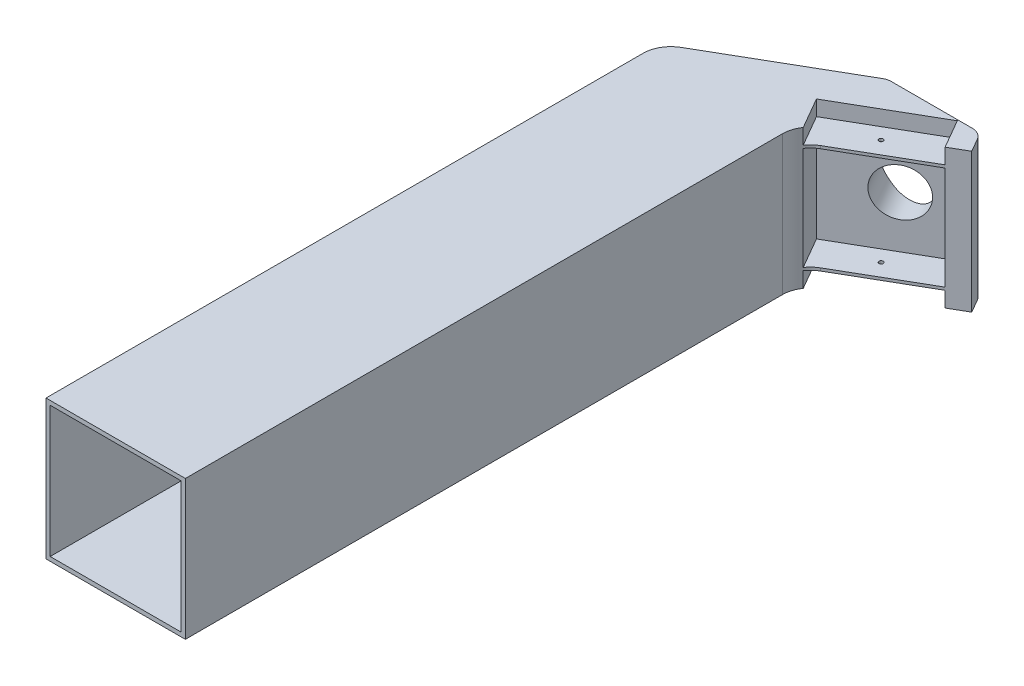
from build123d import *

# Parameters (mm, degrees)
SKETCH_1_W           = 50
SKETCH_1_H           = 50
EXTRUDE_1_DEPTH      = 220
EXTRUDE_2_DEPTH      = 50
SKETCH_4_W           = 37
SKETCH_4_H           = 37
CUT_EXTRUDE_2_DEPTH  = 12
CUT_EXTRUDE_3_REACH  = 235.922
SKETCH_5_R           = 8.5
SKETCH_8_R           = 0.75
CUT_EXTRUDE_4_DEPTH  = 6.5
CUT_EXTRUDE_START    = -6.5
SKETCH_7_R           = 0.75
CUT_EXTRUDE_5_DEPTH  = 6.5
CUT_EXTRUDE_6_DEPTH  = 5.5
CUT_EXTRUDE_7_DEPTH  = 5.5
CUT_EXTRUDE_8_DEPTH  = 50
FILLET_1_R           = 5
FILLET_2_R           = 5
FILLET_3_R           = 10
FILLET_4_R           = 10
SKETCH_13_W          = 47
SKETCH_13_H          = 47
CUT_EXTRUDE_9_DEPTH  = 50
SKETCH_2_W           = 43
SKETCH_2_H           = 43
CUT_EXTRUDE_10_DEPTH = 150
FILLET_5_R           = 5


with BuildPart() as part:
    # 草图1 → 凸台-拉伸1 (new body)
    with BuildSketch(Plane.XY):
        Rectangle(SKETCH_1_W, SKETCH_1_H)
    extrude(amount=EXTRUDE_1_DEPTH)

    # 草图3 → 凸台-拉伸2 (add)
    with BuildSketch(Plane(origin=(0, 25, 0), x_dir=(1, 0, 0), z_dir=(0, 1, 0))):
        Polygon((25, 0), (-25, 0), (26.961524227, 30), (76.961524227, 30), align=None)
    extrude(amount=-EXTRUDE_2_DEPTH)

    # 草图4 → 切除-拉伸2 (cut)
    with BuildSketch(Plane(origin=(6.25, 0, 10.825317547), x_dir=(0.8660254037844415, 0, -0.4999999999999951), z_dir=(0.4999999999999951, 0, 0.8660254037844415))):
        with Locations((41.650635095, 0)):
            Rectangle(SKETCH_4_W, SKETCH_4_H)
    extrude(amount=-CUT_EXTRUDE_2_DEPTH, mode=Mode.SUBTRACT)

    # 切除-拉伸3: up to this face of the body (flat: up to its plane)
    cut_extrude_3_end = Plane(part.part.faces().sort_by_distance((0.980762114, 0, -15))[0])
    # 草图5 → 切除-拉伸3 (cut, up to the picked face)
    with BuildSketch(Plane(origin=(0.25, 0, 0.433012702), x_dir=(0.8660254037844415, 0, -0.4999999999999951), z_dir=(0.4999999999999951, 0, 0.8660254037844415)), mode=Mode.PRIVATE) as cut_extrude_3_sk1:
        with Locations((45.150635095, 0)):
            Circle(SKETCH_5_R)
    cut_extrude_3_tool1 = split(extrude(cut_extrude_3_sk1.sketch, amount=-CUT_EXTRUDE_3_REACH, mode=Mode.PRIVATE), bisect_by=cut_extrude_3_end, keep=Keep.BOTH, mode=Mode.PRIVATE)
    add(cut_extrude_3_tool1.solids().sort_by(Axis((39.351597, 0, -22.142305), (-0.4999999999999951, 0, -0.8660254037844415)))[0], mode=Mode.SUBTRACT)

    # 草图8 → 切除-拉伸4 (cut)
    with BuildSketch(Plane.XZ.offset(-18.5)):
        with Locations((39.170508076, -15.455960044)):
            Circle(SKETCH_8_R)
    extrude(amount=-CUT_EXTRUDE_4_DEPTH, mode=Mode.SUBTRACT)

    # 草图7 → 切除-拉伸5 (cut)
    with BuildSketch(Plane(origin=(0, -18.5, 0), x_dir=(1, 0, 0), z_dir=(0, 1, 0)).offset(CUT_EXTRUDE_START)):
        with Locations((39.170508076, 15.455960044)):
            Circle(SKETCH_7_R)
    extrude(amount=CUT_EXTRUDE_5_DEPTH, mode=Mode.SUBTRACT)

    # 草图10 → 切除-拉伸6 (cut)
    with BuildSketch(Plane.XZ.offset(25)):
        Polygon((58.341978046, -19.25), (26.299038106, -0.75), (20.299038106, -11.142304845), (52.341978046, -29.642304845), align=None)
    extrude(amount=-CUT_EXTRUDE_6_DEPTH, mode=Mode.SUBTRACT)

    # 草图11 → 切除-拉伸7 (cut)
    with BuildSketch(Plane(origin=(0, 25, 0), x_dir=(1, 0, 0), z_dir=(0, 1, 0))):
        Polygon((26.299038106, 0.75), (58.341978046, 19.25), (52.341978046, 29.642304845), (20.299038106, 11.142304845), align=None)
    extrude(amount=-CUT_EXTRUDE_7_DEPTH, mode=Mode.SUBTRACT)

    # 草图12 → 切除-拉伸8 (cut)
    with BuildSketch(Plane.XZ.offset(25)):
        Polygon((64.404155872, -22.75), (60.218366421, -30), (76.961524227, -30), align=None)
    extrude(amount=-CUT_EXTRUDE_8_DEPTH, mode=Mode.SUBTRACT)

    # 圆角1
    fillet_1_edges = [part.edges().sort_by_distance(p)[0] for p in [
        (60.218366421, 0, -30),
    ]]
    fillet(fillet_1_edges, radius=FILLET_1_R)

    # 圆角2
    fillet_2_edges = [part.edges().sort_by_distance(p)[0] for p in [
        (26.961524227, -15.049152987, -30),
    ]]
    fillet(fillet_2_edges, radius=FILLET_2_R)

    # 圆角3
    fillet_3_edges = [part.edges().sort_by_distance(p)[0] for p in [
        (-25, 0, 0),
    ]]
    fillet(fillet_3_edges, radius=FILLET_3_R)

    # 圆角4
    # the kernel refuses this fillet: 10 mm, written as the material it adds along each edge
    with BuildSketch(Plane(origin=(25, 25, 0), x_dir=(0, 0, 1), z_dir=(0, -1, 0))) as fillet_4_piece_1_section:
        with BuildLine():
            CenterArc((FILLET_4_R * 0.57735026919, -FILLET_4_R), FILLET_4_R, 90, 60)
            Line((-FILLET_4_R * 0.288675134595, -FILLET_4_R * 0.5), (0, 0))
            Line((0, 0), (FILLET_4_R * 0.57735026919, 0))
        make_face()
    fillet_4_piece_1 = extrude(amount=50, mode=Mode.PRIVATE)
    fillet_4_piece_1 = split(fillet_4_piece_1, bisect_by=Plane(origin=(26.950281618, 22.25, 0.377986851), z_dir=(-0.8660254037844415, 0, 0.49999999999999517)), keep=Keep.TOP, mode=Mode.PRIVATE)
    add(fillet_4_piece_1)
    with BuildSketch(Plane(origin=(25, 39.43375673, 0), x_dir=(0, 0, 1), z_dir=(0, -1, 0))) as fillet_4_piece_2_section:
        with BuildLine():
            CenterArc((FILLET_4_R * 0.57735026919, -FILLET_4_R), FILLET_4_R, 90, 60)
            Line((-FILLET_4_R * 0.288675134595, -FILLET_4_R * 0.5), (0, 0))
            Line((0, 0), (FILLET_4_R * 0.57735026919, 0))
        make_face()
    fillet_4_piece_2 = extrude(amount=78.867513459, mode=Mode.PRIVATE)
    fillet_4_piece_2 = split(fillet_4_piece_2, bisect_by=Plane(origin=(27.357776316, 19.5, -1.0319296), z_dir=(0, -1, 0)), keep=Keep.TOP, mode=Mode.PRIVATE)
    fillet_4_piece_2 = split(fillet_4_piece_2, bisect_by=Plane(origin=(27.357776316, 18.5, -1.0319296), z_dir=(0, 1, 0)), keep=Keep.TOP, mode=Mode.PRIVATE)
    add(fillet_4_piece_2)
    with BuildSketch(Plane(origin=(25, 39.43375673, 0), x_dir=(0, 0, 1), z_dir=(0, -1, 0))) as fillet_4_piece_3_section:
        with BuildLine():
            CenterArc((FILLET_4_R * 0.57735026919, -FILLET_4_R), FILLET_4_R, 90, 60)
            Line((-FILLET_4_R * 0.288675134595, -FILLET_4_R * 0.5), (0, 0))
            Line((0, 0), (FILLET_4_R * 0.57735026919, 0))
        make_face()
    fillet_4_piece_3 = extrude(amount=78.867513459, mode=Mode.PRIVATE)
    fillet_4_piece_3 = split(fillet_4_piece_3, bisect_by=Plane(origin=(27.357776316, -19.5, -1.0319296), z_dir=(0, 1, 0)), keep=Keep.TOP, mode=Mode.PRIVATE)
    fillet_4_piece_3 = split(fillet_4_piece_3, bisect_by=Plane(origin=(27.357776316, -18.5, -1.0319296), z_dir=(0, -1, 0)), keep=Keep.TOP, mode=Mode.PRIVATE)
    add(fillet_4_piece_3)

    # 草图13 → 切除-拉伸9 (cut)
    with BuildSketch(Plane.XY.offset(220)):
        Rectangle(SKETCH_13_W, SKETCH_13_H)
    extrude(amount=-CUT_EXTRUDE_9_DEPTH, mode=Mode.SUBTRACT)

    # 草图2 → 切除-拉伸10 (cut)
    with BuildSketch(Plane.XY.offset(220)):
        Rectangle(SKETCH_2_W, SKETCH_2_H)
    extrude(amount=-CUT_EXTRUDE_10_DEPTH, mode=Mode.SUBTRACT)

    # 圆角5
    fillet_5_edges = [part.edges().sort_by_distance(p)[0] for p in [
        (26.961524227, 15.049152987, -30),
    ]]
    fillet(fillet_5_edges, radius=FILLET_5_R)


solid = part.part
